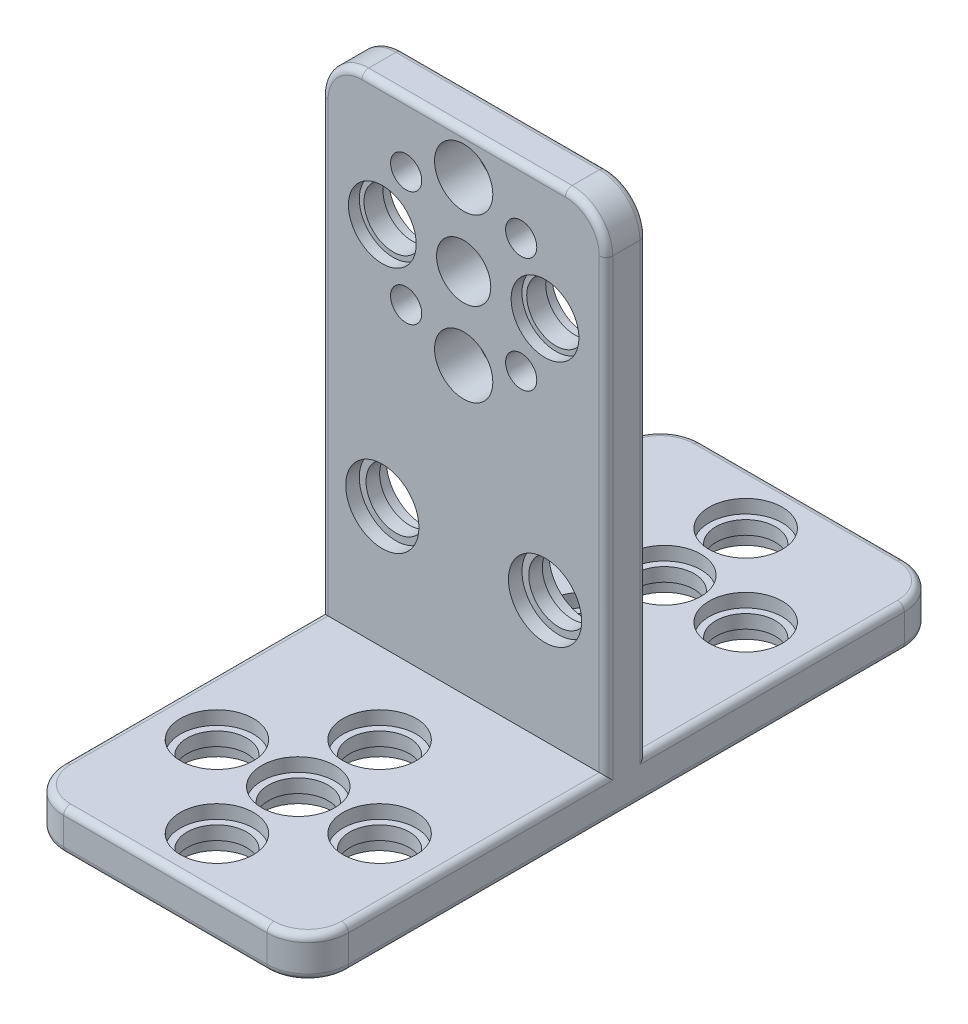
from build123d import *

# Parameters (mm, degrees)
SKETCH1_W                                            = 21
SKETCH1_H                                            = 36
SKETCH1_R                                            = 2.15
SKETCH1_R_2                                          = 2
BOSS_EXTRUDE1_DEPTH                                  = 3
SKETCH2_R                                            = 2.65
SKETCH2_R_2                                          = 2.5
CUT_EXTRUDE1_DEPTH                                   = 0.8
SKETCH5_W                                            = 21
SKETCH5_H                                            = 25
BOSS_EXTRUDE2_DEPTH                                  = 3
HOLE1_D                                              = 4.4
HOLE1_CBORE_D                                        = 5.4
HOLE1_CBORE_DEPTH                                    = 1
CBORE_FOR_M1_6_HEX_SOCKET_HEAD_CAP_SCREW_D           = 2.3
CBORE_FOR_M1_6_HEX_SOCKET_HEAD_CAP_SCREW_CBORE_D     = 4
CBORE_FOR_M1_6_HEX_SOCKET_HEAD_CAP_SCREW_CBORE_DEPTH = 1
HOLE2_D                                              = 4.4
HOLE2_DEPTH                                          = 100
HOLE2_CBORE_D                                        = 5.4
HOLE2_CBORE_DEPTH                                    = 1
SKETCH15_R                                           = 2.5
CUT_EXTRUDE2_DEPTH                                   = 0.8
HOLE3_D                                              = 4.4
HOLE3_DEPTH                                          = 100
HOLE3_CBORE_D                                        = 5.4
HOLE3_CBORE_DEPTH                                    = 1
HOLE4_D                                              = 4.4
HOLE4_DEPTH                                          = 100
HOLE4_CBORE_D                                        = 5.4
HOLE4_CBORE_DEPTH                                    = 1
FILLET4_R                                            = 3
FILLET5_R                                            = 0.5


with BuildPart() as part:
    # Sketch1 → Boss-Extrude1 (new body)
    with BuildSketch(Plane.XY):
        with Locations((0, -9)):
            Rectangle(SKETCH1_W, SKETCH1_H)
        with Locations((-6, 0)):
            Circle(SKETCH1_R, mode=Mode.SUBTRACT)
        with Locations((0, 6)):
            Circle(SKETCH1_R, mode=Mode.SUBTRACT)
        Circle(SKETCH1_R_2, mode=Mode.SUBTRACT)
        with Locations((6, 0)):
            Circle(SKETCH1_R, mode=Mode.SUBTRACT)
        with Locations((0, -6)):
            Circle(SKETCH1_R, mode=Mode.SUBTRACT)
    extrude(amount=BOSS_EXTRUDE1_DEPTH)

    # Sketch2 → Cut-Extrude1 (cut)
    with BuildSketch(Plane.XY.offset(3)):
        with Locations((-6, 0)):
            Circle(SKETCH2_R)
        with Locations((0, 6)):
            Circle(SKETCH2_R)
        with Locations((6, 0)):
            Circle(SKETCH2_R)
        with Locations((0, -6)):
            Circle(SKETCH2_R)
        Circle(SKETCH2_R_2)
    extrude(amount=-CUT_EXTRUDE1_DEPTH, mode=Mode.SUBTRACT)

    # Sketch5 → Boss-Extrude2 (add)
    with BuildSketch(Plane.XZ.offset(27)):
        with Locations((0, 12.5)):
            Rectangle(SKETCH5_W, SKETCH5_H)
    extrude(amount=BOSS_EXTRUDE2_DEPTH)

    # Hole1 (through all)
    with Locations(Plane(origin=(0, -30, 0), x_dir=(-1, 0, 0), z_dir=(0, -1, 0))):
        with Locations((0.2, -21), (6.2, -15), (0.2, -15), (-5.8, -15), (0.2, -9)):
            CounterBoreHole(HOLE1_D / 2, HOLE1_CBORE_D / 2, HOLE1_CBORE_DEPTH)

    # CBORE for M1.6 Hex Socket Head Cap Screw1 (through all)
    with Locations(Plane.XY.offset(3)):
        with Locations((-4.242640687, 4.242640687), (-4.242640687, -4.242640687), (4.242640687, -4.242640687), (4.242640687, 4.242640687)):
            CounterBoreHole(CBORE_FOR_M1_6_HEX_SOCKET_HEAD_CAP_SCREW_D / 2, CBORE_FOR_M1_6_HEX_SOCKET_HEAD_CAP_SCREW_CBORE_D / 2, CBORE_FOR_M1_6_HEX_SOCKET_HEAD_CAP_SCREW_CBORE_DEPTH)

    # Hole2
    with Locations(Plane(origin=(1.593871803, -9.474841874, 0), x_dir=(1, 0, 0), z_dir=(0, 0, -1))):
        with Locations((4.406128197, 8.525158126), (-7.593871803, 8.525158126)):
            CounterBoreHole(HOLE2_D / 2, HOLE2_CBORE_D / 2, HOLE2_CBORE_DEPTH, depth=HOLE2_DEPTH)

    # Sketch15 → Cut-Extrude2 (cut)
    with BuildSketch(Plane(origin=(0, 0, 0), x_dir=(-1, 0, 0), z_dir=(0, 0, -1))):
        with Locations((-6, 0)):
            Circle(SKETCH15_R)
        with Locations((6, 0)):
            Circle(SKETCH15_R)
    extrude(amount=-CUT_EXTRUDE2_DEPTH, mode=Mode.SUBTRACT)

    # Hole3
    with Locations(Plane.XY.offset(3)):
        with Locations((-6, -18), (6, -18)):
            CounterBoreHole(HOLE3_D / 2, HOLE3_CBORE_D / 2, HOLE3_CBORE_DEPTH, depth=HOLE3_DEPTH)

    # Hole4
    with Locations(Plane(origin=(0, -27, 0), x_dir=(1, 0, 0), z_dir=(0, 1, 0))):
        with Locations((-0.2, -21), (-6.2, -15), (-0.2, -15), (5.8, -15), (-0.2, -9)):
            CounterBoreHole(HOLE4_D / 2, HOLE4_CBORE_D / 2, HOLE4_CBORE_DEPTH, depth=HOLE4_DEPTH)

    # Fillet4
    fillet4_edges = [part.edges().sort_by_distance(p)[0] for p in [
        (10.5, -28.5, 25),
        (-10.5, -28.5, 25),
        (-10.5, 9, 1.5),
        (10.5, 9, 1.5),
    ]]
    fillet(fillet4_edges, radius=FILLET4_R)

    # Fillet5
    # the kernel refuses this fillet: 0.5 mm, written as the material it takes off along each edge
    with BuildSketch(Plane(origin=(-10.5, -27, 3), x_dir=(1, 0, 0), z_dir=(0, 0, 1))) as fillet5_piece_1:
        with BuildLine():
            CenterArc((FILLET5_R, -FILLET5_R), FILLET5_R, 90, 90)
            Line((0, -FILLET5_R), (0, 0))
            Line((0, 0), (FILLET5_R, 0))
        make_face()
    extrude(amount=19, mode=Mode.SUBTRACT)
    with BuildSketch(Plane(origin=(10.5, -27, 22), x_dir=(0, -1, 0), z_dir=(0, 0, -1))) as fillet5_piece_2:
        with BuildLine():
            CenterArc((FILLET5_R, FILLET5_R), FILLET5_R, 180, 90)
            Line((0, FILLET5_R), (0, 0))
            Line((0, 0), (FILLET5_R, 0))
        make_face()
    extrude(amount=19, mode=Mode.SUBTRACT)
    with BuildSketch(Plane(origin=(-7.5, -27, 25), x_dir=(0, 0, -1), z_dir=(1, 0, 0)), Plane(origin=(-7.5, 9, 0), x_dir=(0, -1, 0), z_dir=(1, 0, 0))) as fillet5_piece_3:
        with BuildLine():
            CenterArc((FILLET5_R, -FILLET5_R), FILLET5_R, 90, 90)
            Line((0, -FILLET5_R), (0, 0))
            Line((0, 0), (FILLET5_R, 0))
        make_face()
    extrude(amount=15, mode=Mode.SUBTRACT)
    with BuildSketch(Plane(origin=(10.5, -30, 22), x_dir=(0, 1, 0), z_dir=(0, 0, -1))) as fillet5_piece_4:
        with BuildLine():
            CenterArc((FILLET5_R, -FILLET5_R), FILLET5_R, 90, 90)
            Line((0, -FILLET5_R), (0, 0))
            Line((0, 0), (FILLET5_R, 0))
        make_face()
    extrude(amount=23.25, mode=Mode.SUBTRACT)
    with BuildSketch(Plane(origin=(-7.5, -30, 25), x_dir=(0, 0, -1), z_dir=(1, 0, 0)), Plane(origin=(-7.5, 9, 3), x_dir=(0, -1, 0), z_dir=(1, 0, 0))) as fillet5_piece_5:
        with BuildLine():
            CenterArc((FILLET5_R, FILLET5_R), FILLET5_R, 180, 90)
            Line((0, FILLET5_R), (0, 0))
            Line((0, 0), (FILLET5_R, 0))
        make_face()
    extrude(amount=15, mode=Mode.SUBTRACT)
    with BuildSketch(Plane(origin=(-10.5, -30, -1.25), x_dir=(1, 0, 0), z_dir=(0, 0, 1))) as fillet5_piece_6:
        with BuildLine():
            CenterArc((FILLET5_R, FILLET5_R), FILLET5_R, 180, 90)
            Line((0, FILLET5_R), (0, 0))
            Line((0, 0), (FILLET5_R, 0))
        make_face()
    extrude(amount=23.25, mode=Mode.SUBTRACT)
    with BuildSketch(Plane(origin=(-10.5, -31.25, 0), x_dir=(1, 0, 0), z_dir=(0, 1, 0)), Plane(origin=(10.5, -31.25, 0), x_dir=(0, 0, 1), z_dir=(0, 1, 0))) as fillet5_piece_7:
        with BuildLine():
            CenterArc((FILLET5_R, -FILLET5_R), FILLET5_R, 90, 90)
            Line((0, -FILLET5_R), (0, 0))
            Line((0, 0), (FILLET5_R, 0))
        make_face()
    extrude(amount=37.25, mode=Mode.SUBTRACT)
    with BuildSketch(Plane(origin=(10.5, 6, 3), x_dir=(0, 0, -1), z_dir=(0, -1, 0))) as fillet5_piece_8:
        with BuildLine():
            CenterArc((FILLET5_R, -FILLET5_R), FILLET5_R, 90, 90)
            Line((0, -FILLET5_R), (0, 0))
            Line((0, 0), (FILLET5_R, 0))
        make_face()
    extrude(amount=33, mode=Mode.SUBTRACT)
    with BuildSketch(Plane(origin=(-10.5, -27, 3), x_dir=(1, 0, 0), z_dir=(0, 1, 0))) as fillet5_piece_9:
        with BuildLine():
            CenterArc((FILLET5_R, FILLET5_R), FILLET5_R, 180, 90)
            Line((0, FILLET5_R), (0, 0))
            Line((0, 0), (FILLET5_R, 0))
        make_face()
    extrude(amount=33, mode=Mode.SUBTRACT)
    with BuildSketch(Plane(origin=(7.5, -27, 22), x_dir=(1, 0, 0), z_dir=(0, 0, -1))) as fillet5_piece_10:
        with BuildLine():
            CenterArc((3 - FILLET5_R, FILLET5_R), FILLET5_R, 270, 90)
            Line((3, FILLET5_R), (3, 0))
            Line((3, 0), (3 - FILLET5_R, 0))
        make_face()
    revolve(axis=Axis((7.5, -27, 22), (0, -1, 0)), revolution_arc=90, mode=Mode.SUBTRACT)
    with BuildSketch(Plane(origin=(7.5, -30, 22), x_dir=(1, 0, 0), z_dir=(0, 0, -1))) as fillet5_piece_11:
        with BuildLine():
            CenterArc((3 - FILLET5_R, -FILLET5_R), FILLET5_R, 0, 90)
            Line((3 - FILLET5_R, 0), (3, 0))
            Line((3, 0), (3, -FILLET5_R))
        make_face()
    revolve(axis=Axis((7.5, -30, 22), (0, -1, 0)), revolution_arc=90, mode=Mode.SUBTRACT)
    with BuildSketch(Plane(origin=(-7.5, -27, 22), x_dir=(-1, 0, 0), z_dir=(0, 0, -1))) as fillet5_piece_12:
        with BuildLine():
            CenterArc((3 - FILLET5_R, -FILLET5_R), FILLET5_R, 0, 90)
            Line((3, -FILLET5_R), (3, 0))
            Line((3, 0), (3 - FILLET5_R, 0))
        make_face()
    revolve(axis=Axis((-7.5, -27, 22), (0, 1, 0)), revolution_arc=90, mode=Mode.SUBTRACT)
    with BuildSketch(Plane(origin=(-7.5, -30, 22), x_dir=(-1, 0, 0), z_dir=(0, 0, -1))) as fillet5_piece_13:
        with BuildLine():
            CenterArc((3 - FILLET5_R, FILLET5_R), FILLET5_R, 270, 90)
            Line((3, FILLET5_R), (3, 0))
            Line((3, 0), (3 - FILLET5_R, 0))
        make_face()
    revolve(axis=Axis((-7.5, -30, 22), (0, 1, 0)), revolution_arc=90, mode=Mode.SUBTRACT)
    with BuildSketch(Plane(origin=(-7.5, 6, 3), x_dir=(-1, 0, 0), z_dir=(0, -1, 0))) as fillet5_piece_14:
        with BuildLine():
            CenterArc((3 - FILLET5_R, FILLET5_R), FILLET5_R, 270, 90)
            Line((3, FILLET5_R), (3, 0))
            Line((3, 0), (3 - FILLET5_R, 0))
        make_face()
    revolve(axis=Axis((-7.5, 6, 3), (0, 0, -1)), revolution_arc=90, mode=Mode.SUBTRACT)
    with BuildSketch(Plane(origin=(-7.5, 6, 0), x_dir=(-1, 0, 0), z_dir=(0, -1, 0))) as fillet5_piece_15:
        with BuildLine():
            CenterArc((3 - FILLET5_R, -FILLET5_R), FILLET5_R, 0, 90)
            Line((3, -FILLET5_R), (3, 0))
            Line((3, 0), (3 - FILLET5_R, 0))
        make_face()
    revolve(axis=Axis((-7.5, 6, 0), (0, 0, -1)), revolution_arc=90, mode=Mode.SUBTRACT)
    with BuildSketch(Plane(origin=(7.5, 6, 3), x_dir=(1, 0, 0), z_dir=(0, -1, 0))) as fillet5_piece_16:
        with BuildLine():
            CenterArc((3 - FILLET5_R, -FILLET5_R), FILLET5_R, 0, 90)
            Line((3, -FILLET5_R), (3, 0))
            Line((3, 0), (3 - FILLET5_R, 0))
        make_face()
    revolve(axis=Axis((7.5, 6, 3), (0, 0, 1)), revolution_arc=90, mode=Mode.SUBTRACT)
    with BuildSketch(Plane(origin=(7.5, 6, 0), x_dir=(1, 0, 0), z_dir=(0, -1, 0))) as fillet5_piece_17:
        with BuildLine():
            CenterArc((3 - FILLET5_R, FILLET5_R), FILLET5_R, 270, 90)
            Line((3 - FILLET5_R, 0), (3, 0))
            Line((3, 0), (3, FILLET5_R))
        make_face()
    revolve(axis=Axis((7.5, 6, 0), (0, 0, 1)), revolution_arc=90, mode=Mode.SUBTRACT)
    with BuildSketch(Plane(origin=(-10.5, -28.25, 3), x_dir=(1, 0, 0), z_dir=(0, 1, 0))) as fillet5_piece_18a_section:
        with BuildLine():
            CenterArc((FILLET5_R, FILLET5_R), FILLET5_R, 180, 90)
            Line((0, FILLET5_R), (0, 0))
            Line((0, 0), (FILLET5_R, 0))
        make_face()
    fillet5_piece_18a = extrude(amount=34.25, mode=Mode.PRIVATE)
    fillet5_piece_18a = split(fillet5_piece_18a, bisect_by=Plane(origin=(-10.386802443, -27, 2.886802443), z_dir=(0, -1, 0)), keep=Keep.TOP, mode=Mode.PRIVATE)
    with BuildSketch(Plane(origin=(-10.5, -27, 1.75), x_dir=(1, 0, 0), z_dir=(0, 0, 1))) as fillet5_piece_18b_section:
        with BuildLine():
            CenterArc((FILLET5_R, -FILLET5_R), FILLET5_R, 90, 90)
            Line((0, -FILLET5_R), (0, 0))
            Line((0, 0), (FILLET5_R, 0))
        make_face()
    fillet5_piece_18b = extrude(amount=20.25, mode=Mode.PRIVATE)
    fillet5_piece_18b = split(fillet5_piece_18b, bisect_by=Plane(origin=(-10.386802443, -27.113197557, 3), z_dir=(0, 0, -1)), keep=Keep.TOP, mode=Mode.PRIVATE)
    fillet5_piece_18 = fillet5_piece_18a & fillet5_piece_18b
    add(fillet5_piece_18, mode=Mode.SUBTRACT)
    with BuildSketch(Plane(origin=(10.5, 6, 3), x_dir=(0, 0, -1), z_dir=(0, -1, 0))) as fillet5_piece_19a_section:
        with BuildLine():
            CenterArc((FILLET5_R, -FILLET5_R), FILLET5_R, 90, 90)
            Line((0, -FILLET5_R), (0, 0))
            Line((0, 0), (FILLET5_R, 0))
        make_face()
    fillet5_piece_19a = extrude(amount=34.25, mode=Mode.PRIVATE)
    fillet5_piece_19a = split(fillet5_piece_19a, bisect_by=Plane(origin=(10.386802443, -27, 2.886802443), z_dir=(0, -1, 0)), keep=Keep.TOP, mode=Mode.PRIVATE)
    with BuildSketch(Plane(origin=(10.5, -27, 22), x_dir=(0, -1, 0), z_dir=(0, 0, -1))) as fillet5_piece_19b_section:
        with BuildLine():
            CenterArc((FILLET5_R, FILLET5_R), FILLET5_R, 180, 90)
            Line((0, FILLET5_R), (0, 0))
            Line((0, 0), (FILLET5_R, 0))
        make_face()
    fillet5_piece_19b = extrude(amount=20.25, mode=Mode.PRIVATE)
    fillet5_piece_19b = split(fillet5_piece_19b, bisect_by=Plane(origin=(10.386802443, -27.113197557, 3), z_dir=(0, 0, -1)), keep=Keep.TOP, mode=Mode.PRIVATE)
    fillet5_piece_19 = fillet5_piece_19a & fillet5_piece_19b
    add(fillet5_piece_19, mode=Mode.SUBTRACT)

    # Mirror1: part across plane


with BuildPart() as part_1:
    add(part.part)
    add(part.part.mirror(Plane.XY.offset(1.5)))


solid = part_1.part
